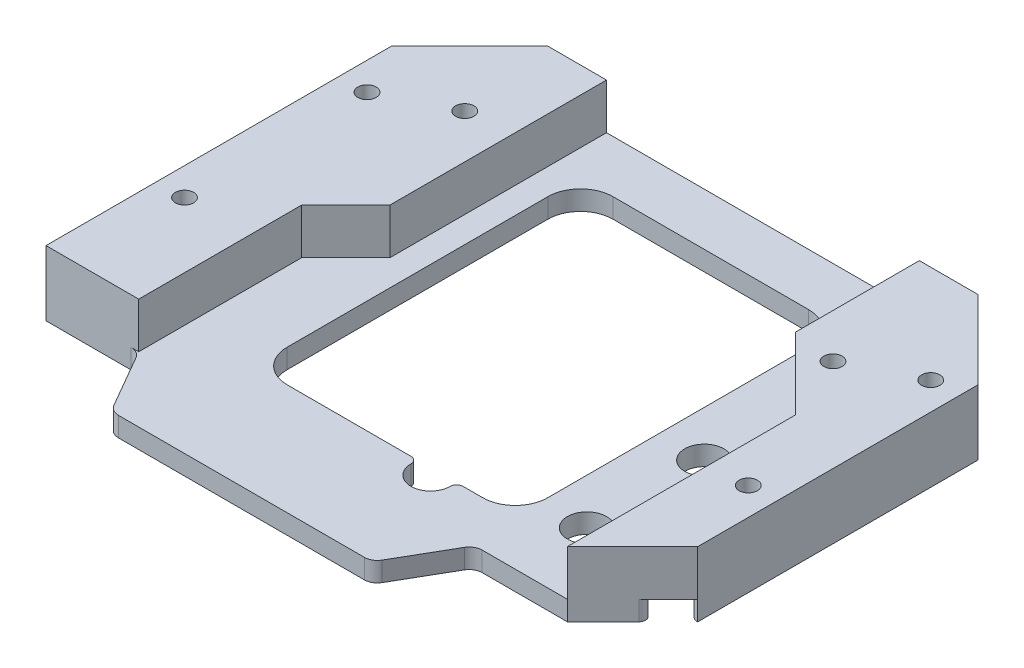
from build123d import *

# Parameters (mm, degrees)
SKETCH_1_R          = 1.4
SKETCH_1_W          = 40
SKETCH_1_H          = 50
EXTRUDE_1_DEPTH     = 3
SKETCH_2_R          = 1.4
EXTRUDE_2_DEPTH     = 7
SKETCH_3_R          = 1.4
CUT_EXTRUDE_1_DEPTH = 7
SKETCH_4_R          = 3
CUT_EXTRUDE_2_DEPTH = 3
FILLET_1_R          = 1
FILLET_2_R          = 2
FILLET_3_R          = 5


with BuildPart() as part:
    # 草图1 → 凸台-拉伸1 (new body)
    with BuildSketch(Plane(origin=(0, 0, 0), x_dir=(1, 0, 0), z_dir=(0, 1, 0))):
        Polygon((-40, 22), (-40, -31), (-25.773502692, -31), (-20, -41), (20, -41), (25.773502692, -31), (40, -31), (50, -21), (50, 22), (38, 34), (-28, 34), align=None)
        with Locations(Location((-35.75, 14, 0), (0, 0, 270))):
            Circle(SKETCH_1_R, mode=Mode.SUBTRACT)
        with Locations(Location((35.75, 14, 0), (0, 0, 270))):
            Circle(SKETCH_1_R, mode=Mode.SUBTRACT)
        with Locations(Location((-35.75, -14, 0), (0, 0, 270))):
            Circle(SKETCH_1_R, mode=Mode.SUBTRACT)
        with Locations(Location((45.75, 19, 0), (0, 0, 270))):
            Circle(SKETCH_1_R, mode=Mode.SUBTRACT)
        with Locations(Location((45.75, -9, 0), (0, 0, 270))):
            Circle(SKETCH_1_R, mode=Mode.SUBTRACT)
        with Locations(Location((-25.75, 19, 0), (0, 0, 270))):
            Circle(SKETCH_1_R, mode=Mode.SUBTRACT)
        with Locations((5, 1)):
            Rectangle(SKETCH_1_W, SKETCH_1_H, mode=Mode.SUBTRACT)
    extrude(amount=EXTRUDE_1_DEPTH)

    # 草图2 → 凸台-拉伸2 (add)
    # profile 1 of 2: a face of its own
    with BuildSketch(Plane(origin=(0, 3, 0), x_dir=(1, 0, 0), z_dir=(0, 1, 0))):
        Polygon((-19, 34), (-19, 0.773502692), (-25.773502692, -6), (-25.773502692, -31), (-40, -31), (-40, 22), (-28, 34), align=None)
        with Locations(Location((-35.75, -14, 0), (0, 0, 270))):
            Circle(SKETCH_2_R, mode=Mode.SUBTRACT)
        with Locations(Location((-35.75, 14, 0), (0, 0, 270))):
            Circle(SKETCH_2_R, mode=Mode.SUBTRACT)
        with Locations(Location((-25.75, 19, 0), (0, 0, 270))):
            Circle(SKETCH_2_R, mode=Mode.SUBTRACT)
    # profile 2 of 2: a face of its own
    with BuildSketch(Plane(origin=(0, 3, 0), x_dir=(1, 0, 0), z_dir=(0, 1, 0))):
        Polygon((29, 34), (29, 15), (40, 4), (40, -31), (50, -21), (50, 22), (38, 34), align=None)
        with Locations(Location((45.75, -9, 0), (0, 0, 270))):
            Circle(SKETCH_2_R, mode=Mode.SUBTRACT)
        with Locations(Location((45.75, 19, 0), (0, 0, 270))):
            Circle(SKETCH_2_R, mode=Mode.SUBTRACT)
        with Locations(Location((35.75, 14, 0), (0, 0, 270))):
            Circle(SKETCH_2_R, mode=Mode.SUBTRACT)
    extrude(amount=EXTRUDE_2_DEPTH)

    # 草图3 → 切除-拉伸1 (cut)
    with BuildSketch(Plane(origin=(0, 0, -34), x_dir=(-1, 0, 0), z_dir=(0, 0, -1))):
        with Locations((-33, 6)):
            Circle(SKETCH_3_R)
        with Locations((23, 6)):
            Circle(SKETCH_3_R)
    extrude(amount=-CUT_EXTRUDE_1_DEPTH, mode=Mode.SUBTRACT)

    # 草图4 → 切除-拉伸2 (cut)
    with BuildSketch(Plane.XZ):
        with Locations((46, 21)):
            Circle(SKETCH_4_R)
        with Locations(Location((46, 1, 0), (0, 0, 270))):
            Circle(SKETCH_4_R)
        with Locations(Location((32, 20, 0), (0, 0, 270))):
            Circle(SKETCH_4_R)
        with Locations(Location((32, 2, 0), (0, 0, 270))):
            Circle(SKETCH_4_R)
        with Locations((13, 25)):
            Circle(SKETCH_4_R)
    extrude(amount=-CUT_EXTRUDE_2_DEPTH, mode=Mode.SUBTRACT)

    # 圆角1
    # the kernel refuses this fillet: 1 mm, written as the material it takes off along each edge
    with BuildSketch(Plane(origin=(47.292893219, 3, 23.707106781), x_dir=(-0.9977260233446211, 0, 0.0674001657336884), z_dir=(0, -1, 0))) as fillet_1_piece_1:
        with BuildLine():
            CenterArc((2.584152116, -0.929364034), FILLET_1_R, 111.664104493, 117.20057038)
            Line((1.926312394, -1.682521985), (1.913155599, -1.697585144))
            Line((1.913155599, -1.697585144), (-0.013156794, -0.015063159))
            Line((-0.013156794, -0.015063159), (0.007383292, 0.018587281))
            ThreePointArc((0.007383292, 0.018587281), (1.107493764, -0.191907899), (2.207604236, 0.018587281))
            Line((2.207604236, 0.018587281), (2.214987528, 0))
        make_face()
    extrude(amount=9.394118228, mode=Mode.SUBTRACT)
    with BuildSketch(Plane(origin=(48.707106781, 3, 22.292893219), x_dir=(0.09729861673044447, 0, -0.9952552331851072), z_dir=(0, -1, 0))) as fillet_1_piece_2:
        with BuildLine():
            CenterArc((2.387842326, 0.940019638), FILLET_1_R, 167.235610317, 82.819244219)
            Line((1.412555464, 1.16096202), (1.393049727, 1.165380868))
            ThreePointArc((1.393049727, 1.165380868), (0.693578708, 0.595932055), (-0.012699024, 0.015451045))
            Line((-0.012699024, 0.015451045), (0.006822407, -0.018800393))
            ThreePointArc((0.006822407, -0.018800393), (1.023360997, 0.159941087), (2.039899587, -0.018800393))
            Line((2.039899587, -0.018800393), (2.046721994, 0))
        make_face()
    extrude(amount=8.116804984, mode=Mode.SUBTRACT)
    with BuildSketch(Plane(origin=(10.171572875, 5.928932188, 24), x_dir=(-1, 0, 0), z_dir=(0, -1, 0))) as fillet_1_piece_3:
        with BuildLine():
            CenterArc((1.171572875, -1), FILLET_1_R, 90, 90)
            Line((0.171572875, -1), (0.151572875, -1))
            ThreePointArc((0.151572875, -1), (0.108656583, -0.496076103), (-0.018856181, -0.006666667))
            Line((-0.018856181, -0.006666667), (0, 0.02))
            Line((0, 0.02), (1.171572875, 0.02))
            Line((1.171572875, 0.02), (1.171572875, 0))
        make_face()
    extrude(amount=8.857864376, mode=Mode.SUBTRACT)
    with BuildSketch(Plane(origin=(15.828427125, 5.928932188, 24), x_dir=(0.1691019787257596, 0, 0.9855985596534894), z_dir=(0, -1, 0))) as fillet_1_piece_4:
        with BuildLine():
            CenterArc((1.183713851, -0.98559856), FILLET_1_R, 99.735610317, 90)
            Line((0.198115291, -1.154700538), (0.17840332, -1.158082578))
            Line((0.17840332, -1.158082578), (-0.019711971, -0.00338204))
            Line((-0.019711971, -0.00338204), (0.00338204, 0.019711971))
            ThreePointArc((0.00338204, 0.019711971), (0.507305936, -0.023204321), (1.011229833, 0.019711971))
            Line((1.011229833, 0.019711971), (1.014611872, 0))
        make_face()
    extrude(amount=8.857864376, mode=Mode.SUBTRACT)

    # 圆角2
    fillet_2_edges = [part.edges().sort_by_distance(p)[0] for p in [
        (25.773502692, 1.5, 31),
        (20, 1.5, 41),
        (-20, 1.5, 41),
        (-25.773502692, 1.5, 31),
    ]]
    fillet(fillet_2_edges, radius=FILLET_2_R)

    # 圆角3
    fillet_3_edges = [part.edges().sort_by_distance(p)[0] for p in [
        (-15, 1.5, -26),
        (-15, 1.5, 24),
        (25, 1.5, 24),
        (25, 1.5, -26),
    ]]
    fillet(fillet_3_edges, radius=FILLET_3_R)


solid = part.part
